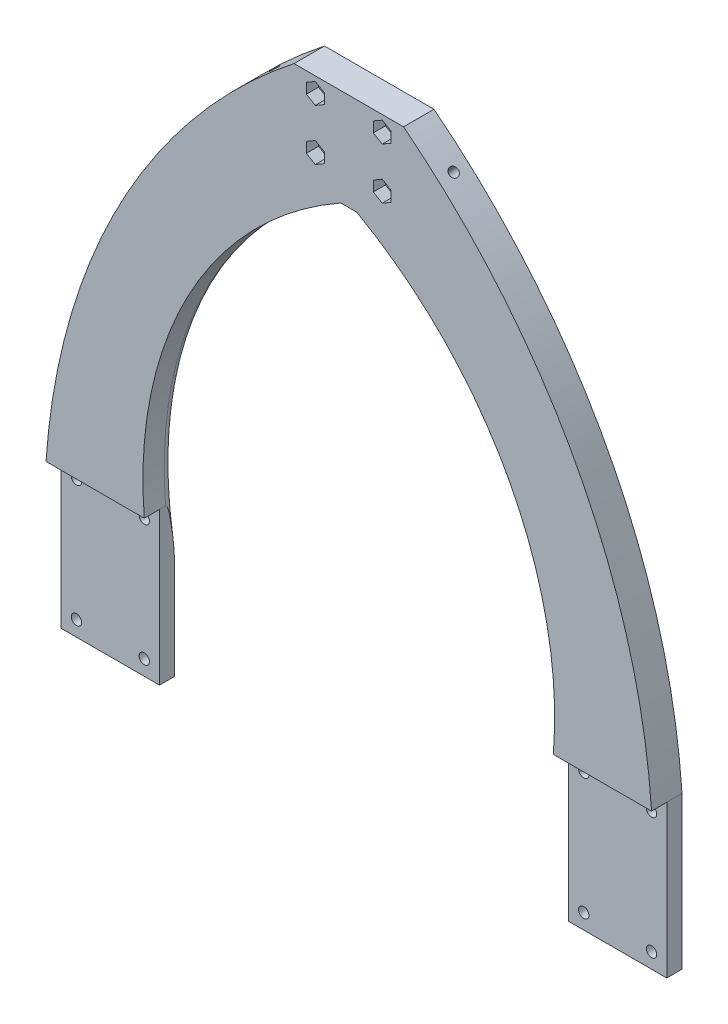
from build123d import *

# Parameters (mm, degrees)
SKIZZE1_W                          = 199
SKIZZE1_H                          = 420
AUFSATZ_LINEAR_AUSTRAGEN1_DEPTH    = 10
SKIZZE5_W                          = 199
SKIZZE5_H                          = 85
SCHNITT_LINEAR_AUSTRAGEN2_DEPTH    = 10
SKIZZE6_R                          = 1.7
SCHNITT_LINEAR_AUSTRAGEN3_DEPTH    = 233.594604409
SCHNITT_LINEAR_AUSTRAGEN4_DEPTH    = 4
SKIZZE20_R                         = 1.7
SCHNITT_LINEAR_AUSTRAGEN12_DEPTH   = 233.594604409
SKIZZE21_W                         = 134.422077922
SKIZZE21_H                         = 75
SCHNITT_LINEAR_AUSTRAGEN13_DEPTH   = 233.594604409
SCHNITT_LINEAR_AUSTRAGEN14_DEPTH   = 233.594604409
AUFSATZ_LINEAR_AUSTRAGEN6_DEPTH    = 10
SKIZZE25_R                         = 1.7
SCHNITT_LINEAR_AUSTRAGEN15_DEPTH   = 233.594604409
SCHNITT_LINEAR_AUSTRAGEN16_DEPTH   = 290.484023739
VERRUNDUNG1_R                      = 3
SCHNITT_LINEAR_START               = -8
SKIZZE28_R                         = 1.5
SCHNITT_LINEAR_AUSTRAGEN17_DEPTH   = 18
K_RPER_VERSCHIEBEN_KOPIEREN1_ANGLE = 90


with BuildPart() as part:
    # Skizze1 → Aufsatz-Linear austragen1 (new body)
    with BuildSketch(Plane(origin=(0, 0, 0), x_dir=(1, 0, 0), z_dir=(0, 1, 0))):
        Rectangle(SKIZZE1_W, SKIZZE1_H)
    extrude(amount=AUFSATZ_LINEAR_AUSTRAGEN1_DEPTH)

    # Skizze5 → Schnitt-Linear austragen2 (cut)
    with BuildSketch(Plane(origin=(0, 10, 0), x_dir=(1, 0, 0), z_dir=(0, 1, 0))):
        Polygon((99.5, -210), (18, -210), (99.5, -56), align=None)
        Polygon((-18, -210), (-99.5, -56), (-99.5, -210), align=None)
        with Locations((0, 167.5)):
            Rectangle(SKIZZE5_W, SKIZZE5_H)
        Polygon((67.211038961, -56), (-67.211038961, -56), (-2.646103896, -178), (2.646103896, -178), align=None)
    extrude(amount=-SCHNITT_LINEAR_AUSTRAGEN2_DEPTH, mode=Mode.SUBTRACT)

    # Skizze6 → Schnitt-Linear austragen3 (cut, through all)
    with BuildSketch(Plane(origin=(0, 10, 0), x_dir=(1, 0, 0), z_dir=(0, 1, 0))):
        with Locations(Location((-11, -205, 0), (0, 0, 270))):
            Circle(SKIZZE6_R)
        with Locations(Location((-11, -188.18, 0), (0, 0, 90))):
            Circle(SKIZZE6_R)
        with Locations(Location((11, -205, 0), (0, 0, 90))):
            Circle(SKIZZE6_R)
        with Locations(Location((11, -188.18, 0), (0, 0, 270))):
            Circle(SKIZZE6_R)
    extrude(amount=-SCHNITT_LINEAR_AUSTRAGEN3_DEPTH, mode=Mode.SUBTRACT)

    # Skizze7 → Schnitt-Linear austragen4 (cut)
    with BuildSketch(Plane.XZ):
        Polygon((-11, 208.406366588), (-8.05, 206.703183294), (-8.05, 203.296816706), (-11, 201.593633412), (-13.95, 203.296816706), (-13.95, 206.703183294), align=None)
        Polygon((11, 208.406366588), (8.05, 206.703183294), (8.05, 203.296816706), (11, 201.593633412), (13.95, 203.296816706), (13.95, 206.703183294), align=None)
        Polygon((-8.05, 186.476816706), (-8.05, 189.883183294), (-11, 191.586366588), (-13.95, 189.883183294), (-13.95, 186.476816706), (-11, 184.773633412), align=None)
        Polygon((8.05, 186.476816706), (8.05, 189.883183294), (11, 191.586366588), (13.95, 189.883183294), (13.95, 186.476816706), (11, 184.773633412), align=None)
    extrude(amount=-SCHNITT_LINEAR_AUSTRAGEN4_DEPTH, mode=Mode.SUBTRACT)

    # Skizze20 → Schnitt-Linear austragen12 (cut, through all)
    with BuildSketch(Plane(origin=(0, 10, 0), x_dir=(1, 0, 0), z_dir=(0, 1, 0))):
        with Locations(Location((90.5, 119.52, 0), (0, 0, 270))):
            Circle(SKIZZE20_R)
        with Locations(Location((48.5, 119.52, 0), (0, 0, 270))):
            Circle(SKIZZE20_R)
        with Locations(Location((-48.5, 119.52, 0), (0, 0, 90))):
            Circle(SKIZZE20_R)
        with Locations(Location((-90.5, 119.52, 0), (0, 0, 90))):
            Circle(SKIZZE20_R)
        with Locations(Location((87, 43.82, 0), (0, 0, 270))):
            Circle(SKIZZE20_R)
        with Locations(Location((52, 43.82, 0), (0, 0, 270))):
            Circle(SKIZZE20_R)
        with Locations(Location((-87, 43.82, 0), (0, 0, 90))):
            Circle(SKIZZE20_R)
        with Locations(Location((-52, 43.82, 0), (0, 0, 90))):
            Circle(SKIZZE20_R)
    extrude(amount=-SCHNITT_LINEAR_AUSTRAGEN12_DEPTH, mode=Mode.SUBTRACT)

    # Skizze21 → Schnitt-Linear austragen13 (cut, through all)
    with BuildSketch(Plane(origin=(0, 10, 0), x_dir=(1, 0, 0), z_dir=(0, 1, 0))):
        with Locations((0, -18.5)):
            Rectangle(SKIZZE21_W, SKIZZE21_H)
    extrude(amount=-SCHNITT_LINEAR_AUSTRAGEN13_DEPTH, mode=Mode.SUBTRACT)

    # Skizze22 → Schnitt-Linear austragen14 (cut, through all)
    with BuildSketch(Plane(origin=(0, 10, 0), x_dir=(1, 0, 0), z_dir=(0, 1, 0))):
        with BuildLine():
            Line((-67.211038961, -56), (-2.646103896, -178))
            ThreePointArc((-2.646103896, -178), (-52.825886854, -126.471631215), (-67.211038961, -56))
        make_face()
    schnitt_linear_austragen14 = extrude(amount=-SCHNITT_LINEAR_AUSTRAGEN14_DEPTH, mode=Mode.SUBTRACT)

    # Skizze23 → Aufsatz-Linear austragen6 (add)
    with BuildSketch(Plane(origin=(0, 10, 0), x_dir=(1, 0, 0), z_dir=(0, 1, 0))):
        with BuildLine():
            Line((-99.5, -56), (-18, -210))
            ThreePointArc((-18, -210), (-75.095260266, -141.650251374), (-99.5, -56))
        make_face()
    aufsatz_linear_austragen6 = extrude(amount=-AUFSATZ_LINEAR_AUSTRAGEN6_DEPTH)

    # Spiegeln2: Schnitt-Linear austragen14, Aufsatz-Linear austragen6 across plane
    add(schnitt_linear_austragen14.mirror(Plane(origin=(0, 0, 0), x_dir=(0, 0, 1), z_dir=(1, 0, 0))), mode=Mode.SUBTRACT)
    add(aufsatz_linear_austragen6.mirror(Plane(origin=(0, 0, 0), x_dir=(0, 0, 1), z_dir=(1, 0, 0))))

    # Skizze25 → Schnitt-Linear austragen15 (cut, through all)
    with BuildSketch(Plane(origin=(0, 10, 0), x_dir=(1, 0, 0), z_dir=(0, 1, 0))):
        with Locations(Location((-94.5, -11, 0), (0, 0, 270))):
            Circle(SKIZZE25_R)
        with Locations(Location((-72.211038961, -11, 0), (0, 0, 90))):
            Circle(SKIZZE25_R)
        with Locations(Location((-72.211038961, -51, 0), (0, 0, 270))):
            Circle(SKIZZE25_R)
        with Locations(Location((-94.5, -51, 0), (0, 0, 90))):
            Circle(SKIZZE25_R)
    schnitt_linear_austragen15 = extrude(amount=-SCHNITT_LINEAR_AUSTRAGEN15_DEPTH, mode=Mode.SUBTRACT)

    # Spiegeln3: Schnitt-Linear austragen15 across plane
    add(schnitt_linear_austragen15.mirror(Plane(origin=(0, 0, 0), x_dir=(0, 0, 1), z_dir=(1, 0, 0))), mode=Mode.SUBTRACT)

    # Skizze26 → Schnitt-Linear austragen16 (cut, through all)
    with BuildSketch(Plane.ZY.offset(99.5)):
        Polygon((56, 5), (56, 0), (4.196805737, -14.401746423), (-137.707729511, -14.401746423), (-137.707729511, 19.508660812), (5.012761814, 19.508660812), (6, 10), (6, 5), align=None)
    extrude(amount=-SCHNITT_LINEAR_AUSTRAGEN16_DEPTH, mode=Mode.SUBTRACT)

    # Verrundung1
    # the kernel refuses this fillet: 3 mm, written as the material it takes off along each edge
    with BuildSketch(Plane(origin=(60.076908998, 10, 66.721125619), x_dir=(-0.4390500946900349, 0, 0.8984625837243705), z_dir=(0.8984625837243705, 0, 0.4390500946900349))) as verrundung1_piece_1_section:
        with BuildLine():
            CenterArc((127.738655974 + VERRUNDUNG1_R, VERRUNDUNG1_R), VERRUNDUNG1_R, 180, 90)
            Line((127.738655974, VERRUNDUNG1_R), (127.738655974, 0))
            Line((127.738655974, 0), (127.738655974 + VERRUNDUNG1_R, 0))
        make_face()
    verrundung1_piece_1 = revolve(axis=Axis((60.076908998, 10, 66.721125619), (0, -1, 0)), revolution_arc=78.865488706, mode=Mode.PRIVATE)
    verrundung1_piece_1 = split(verrundung1_piece_1, bisect_by=Plane(origin=(60.076908998, 10, 178), z_dir=(0, 0, -1)), keep=Keep.TOP, mode=Mode.PRIVATE)
    add(verrundung1_piece_1, mode=Mode.SUBTRACT)
    with BuildSketch(Plane(origin=(-60.076908998, 10, 66.721125619), x_dir=(0.4390500946900349, 0, 0.8984625837243705), z_dir=(-0.8984625837243705, 0, 0.4390500946900349))) as verrundung1_piece_2_section:
        with BuildLine():
            CenterArc((127.738655974 + VERRUNDUNG1_R, -VERRUNDUNG1_R), VERRUNDUNG1_R, 90, 90)
            Line((127.738655974, -VERRUNDUNG1_R), (127.738655974, 0))
            Line((127.738655974, 0), (127.738655974 + VERRUNDUNG1_R, 0))
        make_face()
    verrundung1_piece_2 = revolve(axis=Axis((-60.076908998, 10, 66.721125619), (0, 1, 0)), revolution_arc=78.865488706, mode=Mode.PRIVATE)
    verrundung1_piece_2 = split(verrundung1_piece_2, bisect_by=Plane(origin=(-60.076908998, 10, 178), z_dir=(0, 0, -1)), keep=Keep.TOP, mode=Mode.PRIVATE)
    add(verrundung1_piece_2, mode=Mode.SUBTRACT)
    with BuildSketch(Plane(origin=(-10.146103896, 10, 178), x_dir=(0, 0, 1), z_dir=(1, 0, 0))) as verrundung1_piece_3_section:
        with BuildLine():
            CenterArc((VERRUNDUNG1_R, VERRUNDUNG1_R), VERRUNDUNG1_R, 180, 90)
            Line((0, VERRUNDUNG1_R), (0, 0))
            Line((0, 0), (VERRUNDUNG1_R, 0))
        make_face()
    verrundung1_piece_3 = extrude(amount=20.292207792, mode=Mode.PRIVATE)
    verrundung1_piece_3 = verrundung1_piece_3 & Plane(origin=(60.076908998, 10, 66.721125619), x_dir=(-0.4910260908528423, 0, 0.8711448663120137), z_dir=(0, 1, 0)) * Cylinder(127.738655974, 53, mode=Mode.PRIVATE)
    verrundung1_piece_3 = verrundung1_piece_3 & Plane(origin=(-60.076908998, 10, 66.721125619), x_dir=(0.4910260908528423, 0, 0.8711448663120137), z_dir=(0, 1, 0)) * Cylinder(127.738655974, 53, mode=Mode.PRIVATE)
    add(verrundung1_piece_3, mode=Mode.SUBTRACT)
    with BuildSketch(Plane(origin=(-10.146103896, 10, 178), x_dir=(0, 0, 1), z_dir=(1, 0, 0))) as verrundung1_piece_4_section:
        with BuildLine():
            CenterArc((VERRUNDUNG1_R, VERRUNDUNG1_R), VERRUNDUNG1_R, 180, 90)
            Line((0, VERRUNDUNG1_R), (0, 0))
            Line((0, 0), (VERRUNDUNG1_R, 0))
        make_face()
    verrundung1_piece_4 = extrude(amount=20.292207792, mode=Mode.PRIVATE)
    verrundung1_piece_4 = verrundung1_piece_4 - Plane(origin=(60.076908998, 10, 66.721125619), x_dir=(-0.4910260908528423, 0, 0.8711448663120137), z_dir=(0, 1, 0)) * Cylinder(127.738655974, 53, mode=Mode.PRIVATE)
    verrundung1_piece_4 = verrundung1_piece_4 - Plane(origin=(-60.076908998, 10, 66.721125619), x_dir=(0.4910260908528423, 0, 0.8711448663120137), z_dir=(0, 1, 0)) * Cylinder(127.738655974, 53, mode=Mode.PRIVATE)
    add(verrundung1_piece_4, mode=Mode.SUBTRACT)
    with BuildSketch(Plane(origin=(60.076908998, 10, 66.721125619), x_dir=(-0.4390500946900349, 0, 0.8984625837243705), z_dir=(0.8984625837243705, 0, 0.4390500946900349))) as verrundung1_piece_5a_section:
        with BuildLine():
            CenterArc((127.738655974 + VERRUNDUNG1_R, VERRUNDUNG1_R), VERRUNDUNG1_R, 180, 90)
            Line((127.738655974, VERRUNDUNG1_R), (127.738655974, 0))
            Line((127.738655974, 0), (127.738655974 + VERRUNDUNG1_R, 0))
        make_face()
    verrundung1_piece_5a = revolve(axis=Axis((60.076908998, 10, 66.721125619), (0, -1, 0)), revolution_arc=78.865488706, mode=Mode.PRIVATE)
    verrundung1_piece_5a = split(verrundung1_piece_5a, bisect_by=Plane(origin=(60.076908998, 10, 178), z_dir=(0, 0, 1)), keep=Keep.TOP, mode=Mode.PRIVATE)
    with BuildSketch(Plane(origin=(-10.146103896, 10, 178), x_dir=(0, 0, 1), z_dir=(1, 0, 0))) as verrundung1_piece_5b_section:
        with BuildLine():
            CenterArc((VERRUNDUNG1_R, VERRUNDUNG1_R), VERRUNDUNG1_R, 180, 90)
            Line((0, VERRUNDUNG1_R), (0, 0))
            Line((0, 0), (VERRUNDUNG1_R, 0))
        make_face()
    verrundung1_piece_5b = extrude(amount=20.292207792, mode=Mode.PRIVATE)
    verrundung1_piece_5b = verrundung1_piece_5b - Plane(origin=(60.076908998, 10, 66.721125619), x_dir=(-0.4910260908528423, 0, 0.8711448663120137), z_dir=(0, 1, 0)) * Cylinder(127.738655974, 53, mode=Mode.PRIVATE)
    verrundung1_piece_5b = verrundung1_piece_5b & Plane(origin=(-60.076908998, 10, 66.721125619), x_dir=(0.4910260908528423, 0, 0.8711448663120137), z_dir=(0, 1, 0)) * Cylinder(127.738655974, 53, mode=Mode.PRIVATE)
    verrundung1_piece_5 = verrundung1_piece_5a & verrundung1_piece_5b
    add(verrundung1_piece_5, mode=Mode.SUBTRACT)
    with BuildSketch(Plane(origin=(-10.146103896, 10, 178), x_dir=(0, 0, 1), z_dir=(1, 0, 0))) as verrundung1_piece_6a_section:
        with BuildLine():
            CenterArc((VERRUNDUNG1_R, VERRUNDUNG1_R), VERRUNDUNG1_R, 180, 90)
            Line((0, VERRUNDUNG1_R), (0, 0))
            Line((0, 0), (VERRUNDUNG1_R, 0))
        make_face()
    verrundung1_piece_6a = extrude(amount=20.292207792, mode=Mode.PRIVATE)
    verrundung1_piece_6a = verrundung1_piece_6a & Plane(origin=(60.076908998, 10, 66.721125619), x_dir=(-0.4910260908528423, 0, 0.8711448663120137), z_dir=(0, 1, 0)) * Cylinder(127.738655974, 53, mode=Mode.PRIVATE)
    verrundung1_piece_6a = verrundung1_piece_6a - Plane(origin=(-60.076908998, 10, 66.721125619), x_dir=(0.4910260908528423, 0, 0.8711448663120137), z_dir=(0, 1, 0)) * Cylinder(127.738655974, 53, mode=Mode.PRIVATE)
    with BuildSketch(Plane(origin=(-60.076908998, 10, 66.721125619), x_dir=(0.4390500946900349, 0, 0.8984625837243705), z_dir=(-0.8984625837243705, 0, 0.4390500946900349))) as verrundung1_piece_6b_section:
        with BuildLine():
            CenterArc((127.738655974 + VERRUNDUNG1_R, -VERRUNDUNG1_R), VERRUNDUNG1_R, 90, 90)
            Line((127.738655974, -VERRUNDUNG1_R), (127.738655974, 0))
            Line((127.738655974, 0), (127.738655974 + VERRUNDUNG1_R, 0))
        make_face()
    verrundung1_piece_6b = revolve(axis=Axis((-60.076908998, 10, 66.721125619), (0, 1, 0)), revolution_arc=78.865488706, mode=Mode.PRIVATE)
    verrundung1_piece_6b = split(verrundung1_piece_6b, bisect_by=Plane(origin=(-60.076908998, 10, 178), z_dir=(0, 0, 1)), keep=Keep.TOP, mode=Mode.PRIVATE)
    verrundung1_piece_6 = verrundung1_piece_6a & verrundung1_piece_6b
    add(verrundung1_piece_6, mode=Mode.SUBTRACT)

    # Skizze28 → Schnitt-Linear austragen17 (cut)
    with BuildSketch(Plane(origin=(112.588986226, 0, 124.373227212), x_dir=(0.7413553660235626, -3.83472624348763e-15, -0.6711126740481583), z_dir=(0.6711126740481583, 4.386064313365748e-15, 0.7413553660235626)).offset(SCHNITT_LINEAR_START)):
        with Locations(Location((-112.589264962, 5, 0), (0, 0, 180))):
            Circle(SKIZZE28_R)
    schnitt_linear_austragen17 = extrude(amount=SCHNITT_LINEAR_AUSTRAGEN17_DEPTH, mode=Mode.SUBTRACT)

    # Spiegeln4: Schnitt-Linear austragen17 across plane
    add(schnitt_linear_austragen17.mirror(Plane(origin=(0, 0, 0), x_dir=(0, 0, 1), z_dir=(1, 0, 0))), mode=Mode.SUBTRACT)


with BuildPart() as part_1:
    # Körper-Verschieben/Kopieren1: moved
    add(part.part.rotate(Axis((0, 5.338020233, 108), (-1, 0, 0)), K_RPER_VERSCHIEBEN_KOPIEREN1_ANGLE))


solid = part_1.part
